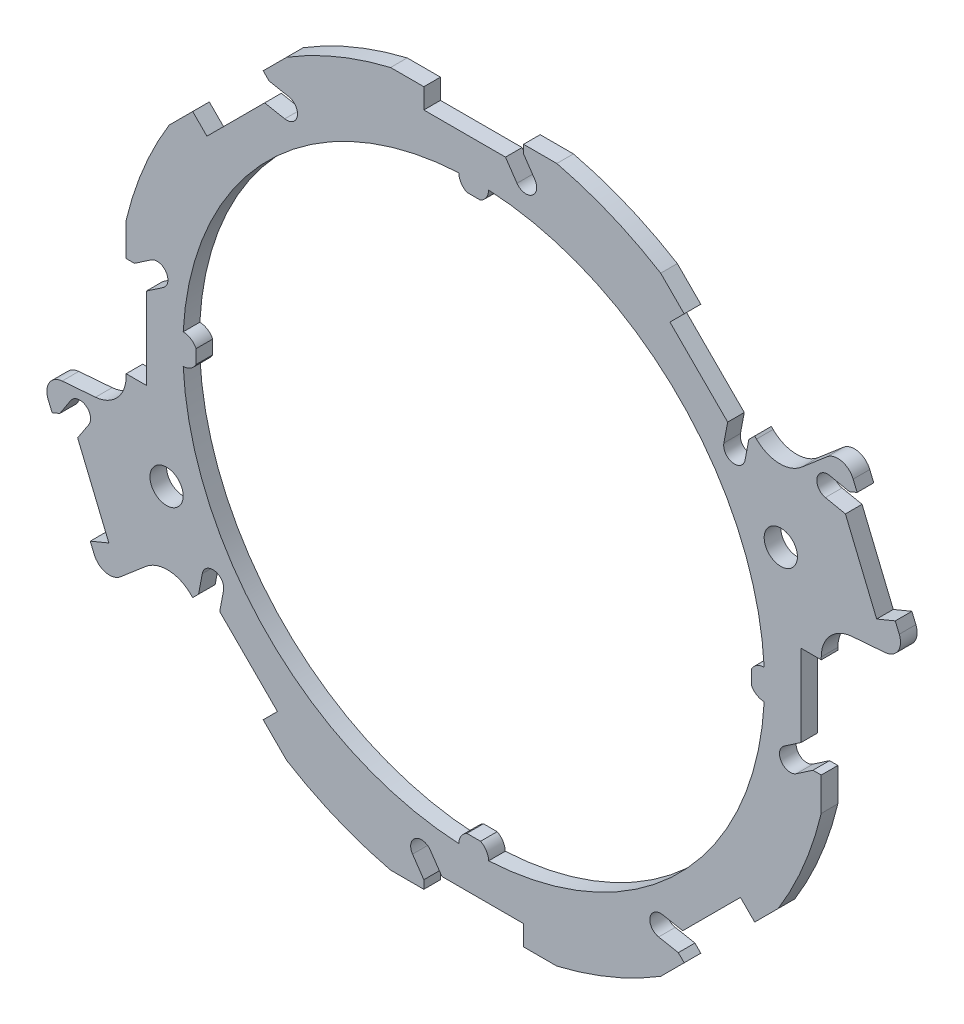
from build123d import *

# Parameters (mm, degrees)
BOSS_EXTRU_1_OUTLINE_R = 5
BOSS_EXTRU_1_DEPTH     = 5
CONG_2_R               = 10
CONG_3_R               = 5


# Read off the part's stored shape, not the designer's step: Boss.-Extru.1
with BuildPart() as part:
    # Boss.-Extru.1 outline → Boss.-Extru.1 (new body)
    with BuildSketch(Plane.XY):
        with BuildLine():
            Line((111.825417275, 56.670302216), (105.808192277, 57.923261539))
            ThreePointArc((105.808192277, 57.923261539), (103.288971945, 61.767546768), (107.133257174, 64.2867671))
            Line((107.133257174, 64.2867671), (113.037155155, 63.057405721))
            Line((113.037155155, 63.057405721), (115.346853986, 64.014114302))
            Line((115.346853986, 64.014114302), (111.520019662, 73.252909628))
            Line((111.520019662, 73.252909628), (91.607534943, 56.252195883))
            Line((91.607534943, 56.252195883), (84.536467131, 63.323263695))
            Line((84.536467131, 63.323263695), (82.768700178, 61.555496742))
            Line((82.768700178, 61.555496742), (81.64515805, 55.630550004))
            ThreePointArc((81.64515805, 55.630550004), (77.846557681, 53.042957448), (75.258965125, 56.841557817))
            Line((75.258965125, 56.841557817), (76.404073966, 62.880235609))
            Line((76.404073966, 62.880235609), (59.03555307, 80.248756505))
            Line((59.03555307, 80.248756505), (63.323263695, 84.536467131))
            Line((63.323263695, 84.536467131), (56.252195883, 91.607534943))
            ThreePointArc((56.252195883, 91.607534943), (41.138468979, 99.317049745), (25, 104.552618332))
            Line((25, 104.552618332), (15, 104.552618332))
            Line((15, 104.552618332), (15, 102.052618332))
            Line((15, 102.052618332), (18.395105759, 97.068584057))
            ThreePointArc((18.395105759, 97.068584057), (17.538793922, 92.552863734), (13.023073599, 93.40917557))
            Line((13.023073599, 93.40917557), (9.56279781, 98.488879813))
            Line((9.56279781, 98.488879813), (-15, 98.488879813))
            Line((-15, 98.488879813), (-15, 104.552618332))
            Line((-15, 104.552618332), (-25, 104.552618332))
            ThreePointArc((-25, 104.552618332), (-41.138468979, 99.317049745), (-56.252195883, 91.607534943))
            Line((-56.252195883, 91.607534943), (-63.323263695, 84.536467131))
            Line((-63.323263695, 84.536467131), (-61.555496742, 82.768700178))
            Line((-61.555496742, 82.768700178), (-55.630550004, 81.64515805))
            ThreePointArc((-55.630550004, 81.64515805), (-53.042957448, 77.846557681), (-56.841557817, 75.258965125))
            Line((-56.841557817, 75.258965125), (-62.880235609, 76.404073966))
            Line((-62.880235609, 76.404073966), (-80.248756505, 59.03555307))
            Line((-80.248756505, 59.03555307), (-84.536467131, 63.323263695))
            Line((-84.536467131, 63.323263695), (-91.607534943, 56.252195883))
            ThreePointArc((-91.607534943, 56.252195883), (-99.317049745, 41.138468979), (-104.552618332, 25))
            Line((-104.552618332, 25), (-104.552618332, 15))
            Line((-104.552618332, 15), (-102.052618332, 15))
            Line((-102.052618332, 15), (-97.068584057, 18.395105759))
            ThreePointArc((-97.068584057, 18.395105759), (-92.552863734, 17.538793922), (-93.40917557, 13.023073599))
            Line((-93.40917557, 13.023073599), (-98.488879813, 9.56279781))
            Line((-98.488879813, 9.56279781), (-98.488879813, -15))
            Line((-98.488879813, -15), (-104.552618332, -15))
            Line((-104.552618332, -15), (-104.552618332, -25))
            Line((-104.552618332, -25), (-130.65419128, -27.058933002))
            Line((-130.65419128, -27.058933002), (-126.827356957, -36.297728327))
            Line((-126.827356957, -36.297728327), (-124.517658126, -35.341019746))
            Line((-124.517658126, -35.341019746), (-121.212261595, -30.297043681))
            ThreePointArc((-121.212261595, -30.297043681), (-116.712583661, -29.360081308), (-115.775621287, -33.859759242))
            Line((-115.775621287, -33.859759242), (-119.144465853, -39.000555875))
            Line((-119.144465853, -39.000555875), (-109.744690078, -61.693622033))
            Line((-109.744690078, -61.693622033), (-115.346853986, -64.014114302))
            Line((-115.346853986, -64.014114302), (-111.520019662, -73.252909628))
            Line((-111.520019662, -73.252909628), (-91.607534943, -56.252195883))
            Line((-91.607534943, -56.252195883), (-84.536467131, -63.323263695))
            Line((-84.536467131, -63.323263695), (-82.768700178, -61.555496742))
            Line((-82.768700178, -61.555496742), (-81.64515805, -55.630550004))
            ThreePointArc((-81.64515805, -55.630550004), (-77.846557681, -53.042957448), (-75.258965125, -56.841557817))
            Line((-75.258965125, -56.841557817), (-76.404073966, -62.880235609))
            Line((-76.404073966, -62.880235609), (-59.03555307, -80.248756505))
            Line((-59.03555307, -80.248756505), (-63.323263695, -84.536467131))
            Line((-63.323263695, -84.536467131), (-56.252195883, -91.607534943))
            ThreePointArc((-56.252195883, -91.607534943), (-41.138468979, -99.317049745), (-25, -104.552618332))
            Line((-25, -104.552618332), (-15, -104.552618332))
            Line((-15, -104.552618332), (-15, -102.052618332))
            Line((-15, -102.052618332), (-18.395105759, -97.068584057))
            ThreePointArc((-18.395105759, -97.068584057), (-17.538793922, -92.552863734), (-13.023073599, -93.40917557))
            Line((-13.023073599, -93.40917557), (-9.56279781, -98.488879813))
            Line((-9.56279781, -98.488879813), (15, -98.488879813))
            Line((15, -98.488879813), (15, -104.552618332))
            Line((15, -104.552618332), (25, -104.552618332))
            ThreePointArc((25, -104.552618332), (41.138468979, -99.317049745), (56.252195883, -91.607534943))
            Line((56.252195883, -91.607534943), (63.323263695, -84.536467131))
            Line((63.323263695, -84.536467131), (61.555496742, -82.768700178))
            Line((61.555496742, -82.768700178), (55.630550004, -81.64515805))
            ThreePointArc((55.630550004, -81.64515805), (53.042957448, -77.846557681), (56.841557817, -75.258965125))
            Line((56.841557817, -75.258965125), (62.880235609, -76.404073966))
            Line((62.880235609, -76.404073966), (80.248756505, -59.03555307))
            Line((80.248756505, -59.03555307), (84.536467131, -63.323263695))
            Line((84.536467131, -63.323263695), (91.607534943, -56.252195883))
            ThreePointArc((91.607534943, -56.252195883), (99.317049745, -41.138468979), (104.552618332, -25))
            Line((104.552618332, -25), (104.552618332, -15))
            Line((104.552618332, -15), (102.052618332, -15))
            Line((102.052618332, -15), (97.068584057, -18.395105759))
            ThreePointArc((97.068584057, -18.395105759), (92.552863734, -17.538793922), (93.40917557, -13.023073599))
            Line((93.40917557, -13.023073599), (98.488879813, -9.56279781))
            Line((98.488879813, -9.56279781), (98.488879813, 15))
            Line((98.488879813, 15), (104.552618332, 15))
            Line((104.552618332, 15), (104.552618332, 25))
            Line((104.552618332, 25), (130.65419128, 27.058933002))
            Line((130.65419128, 27.058933002), (126.827356957, 36.297728327))
            Line((126.827356957, 36.297728327), (121.225193049, 33.977236058))
            Line((121.225193049, 33.977236058), (111.825417275, 56.670302216))
        make_face()
        with Locations((-92.387953251, -38.268343237)):
            Circle(BOSS_EXTRU_1_OUTLINE_R, mode=Mode.SUBTRACT)
        with BuildLine():
            ThreePointArc((-2.061552813, -83.5), (-3.811893422, -85.108458961), (-4.498511999, -87.384285714))
            ThreePointArc((-4.498511999, -87.384285714), (-61.871843354, -61.871843354), (-87.384285714, -4.498511999))
            ThreePointArc((-87.384285714, -4.498511999), (-85.108458961, -3.811893422), (-83.5, -2.061552813))
            Line((-83.5, -2.061552813), (-83.5, 2.061552813))
            ThreePointArc((-83.5, 2.061552813), (-85.108458961, 3.811893422), (-87.384285714, 4.498511999))
            ThreePointArc((-87.384285714, 4.498511999), (-61.871843354, 61.871843354), (-4.498511999, 87.384285714))
            ThreePointArc((-4.498511999, 87.384285714), (-3.811893422, 85.108458961), (-2.061552813, 83.5))
            Line((-2.061552813, 83.5), (2.061552813, 83.5))
            ThreePointArc((2.061552813, 83.5), (3.811893422, 85.108458961), (4.498511999, 87.384285714))
            ThreePointArc((4.498511999, 87.384285714), (61.871843354, 61.871843354), (87.384285714, 4.498511999))
            ThreePointArc((87.384285714, 4.498511999), (85.108458961, 3.811893422), (83.5, 2.061552813))
            Line((83.5, 2.061552813), (83.5, -2.061552813))
            ThreePointArc((83.5, -2.061552813), (85.108458961, -3.811893422), (87.384285714, -4.498511999))
            ThreePointArc((87.384285714, -4.498511999), (61.871843354, -61.871843354), (4.498511999, -87.384285714))
            ThreePointArc((4.498511999, -87.384285714), (3.811893422, -85.108458961), (2.061552813, -83.5))
            Line((2.061552813, -83.5), (-2.061552813, -83.5))
        make_face(mode=Mode.SUBTRACT)
        with Locations((92.387953251, 38.268343237)):
            Circle(BOSS_EXTRU_1_OUTLINE_R, mode=Mode.SUBTRACT)
    extrude(amount=BOSS_EXTRU_1_DEPTH)

    # Congé2
    cong_2_edges = [part.edges().sort_by_distance(p)[0] for p in [
        (104.552618332, 25, 2.5),
        (-91.607534943, -56.252195883, 2.5),
        (-104.552618332, -25, 2.5),
        (91.607534943, 56.252195883, 2.5),
    ]]
    fillet(cong_2_edges, radius=CONG_2_R)

    # Congé3
    cong_3_edges = [part.edges().sort_by_distance(p)[0] for p in [
        (130.65419128, 27.058933002, 2.5),
        (-111.520019662, -73.252909628, 2.5),
        (-130.65419128, -27.058933002, 2.5),
        (111.520019662, 73.252909628, 2.5),
    ]]
    fillet(cong_3_edges, radius=CONG_3_R)


solid = part.part
